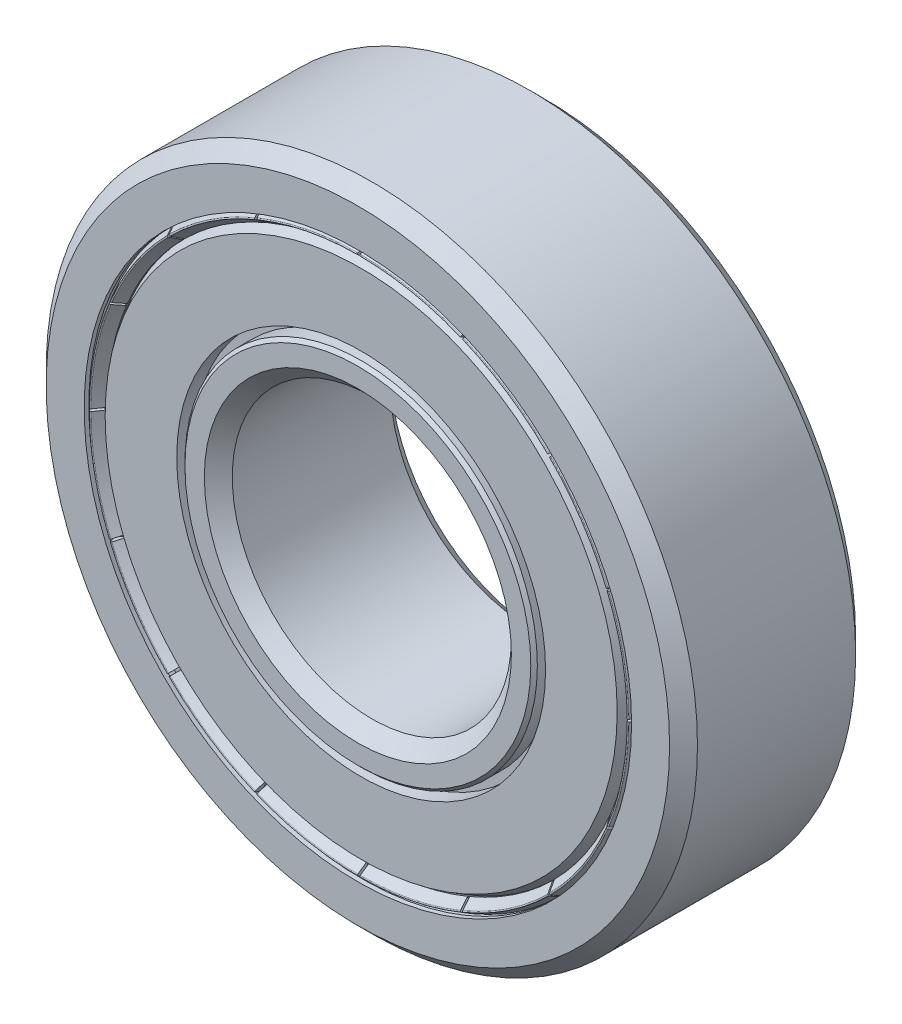
from build123d import *

# Parameters (mm, degrees)
CIRPATTERN1_COUNT  = 8
FILLET1_R          = 0.04
CUT_EXTRUDE1_START = 3.536162
CUT_EXTRUDE1_DEPTH = 17.662847877
CIRPATTERN2_COUNT  = 16


with BuildPart() as part:
    # Sketch3 → Revolve1 (revolve)
    with BuildSketch(Plane(origin=(0, 0, 0), x_dir=(0, 0, -1), z_dir=(1, 0, 0)), mode=Mode.PRIVATE) as revolve1_sk:
        with BuildLine():
            Line((3.4, 14), (-3.4, 14))
            Line((-3.4, 14), (-4, 13.4))
            Line((-4, 13.4), (-4, 11.766899549))
            Line((-4, 11.766899549), (-3.8, 11.766899549))
            Line((-3.8, 11.766899549), (-3.8, 12.283449774))
            Line((-3.8, 12.283449774), (-3.658578644, 12.424871131))
            Line((-3.658578644, 12.424871131), (-1.4, 12.424871131))
            ThreePointArc((-1.4, 12.424871131), (0, 12.8), (1.4, 12.424871131))
            Line((1.4, 12.424871131), (3.658578644, 12.424871131))
            Line((3.658578644, 12.424871131), (3.8, 12.283449774))
            Line((3.8, 12.283449774), (3.8, 11.766899549))
            Line((3.8, 11.766899549), (4, 11.766899549))
            Line((4, 11.766899549), (4, 13.4))
            Line((4, 13.4), (3.4, 14))
        make_face()
        with BuildLine():
            Line((3.4, 6), (-3.4, 6))
            Line((-3.4, 6), (-4, 6.6))
            Line((-4, 6.6), (-4, 7.433707513))
            Line((-4, 7.433707513), (-3.858578644, 7.575128869))
            Line((-3.858578644, 7.575128869), (-1.4, 7.575128869))
            ThreePointArc((-1.4, 7.575128869), (0, 7.2), (1.4, 7.575128869))
            Line((1.4, 7.575128869), (3.858578644, 7.575128869))
            Line((3.858578644, 7.575128869), (4, 7.433707513))
            Line((4, 7.433707513), (4, 6.6))
            Line((4, 6.6), (3.4, 6))
        make_face()
    revolve(revolve1_sk.sketch.rotate(Axis((0, 0, 4), (0, 0, -1)), 90), axis=Axis((0, 0, 4), (0, 0, -1)))


with BuildPart() as body_2:
    # Sketch4 → Revolve2 (revolve)
    with BuildSketch(Plane(origin=(0, 0, 0), x_dir=(0, 0, -1), z_dir=(1, 0, 0))):
        with BuildLine():
            Line((0, 12.8), (0, 7.2))
            ThreePointArc((0, 7.2), (-2.8, 10), (0, 12.8))
        make_face()
    revolve(axis=Axis((0, 14, 0), (0, -1, 0)))


with BuildPart() as cirpattern1_1:
    # CirPattern1: pattern copy
    add(body_2.part.rotate(Axis((0, 0, 0), (0, 0, 1)), 1 * 360 / CIRPATTERN1_COUNT))


with BuildPart() as cirpattern1_2:
    # CirPattern1: pattern copy
    add(body_2.part.rotate(Axis((0, 0, 0), (0, 0, 1)), 2 * 360 / CIRPATTERN1_COUNT))


with BuildPart() as cirpattern1_3:
    # CirPattern1: pattern copy
    add(body_2.part.rotate(Axis((0, 0, 0), (0, 0, 1)), 3 * 360 / CIRPATTERN1_COUNT))


with BuildPart() as cirpattern1_4:
    # CirPattern1: pattern copy
    add(body_2.part.rotate(Axis((0, 0, 0), (0, 0, 1)), 4 * 360 / CIRPATTERN1_COUNT))


with BuildPart() as cirpattern1_5:
    # CirPattern1: pattern copy
    add(body_2.part.rotate(Axis((0, 0, 0), (0, 0, 1)), 5 * 360 / CIRPATTERN1_COUNT))


with BuildPart() as cirpattern1_6:
    # CirPattern1: pattern copy
    add(body_2.part.rotate(Axis((0, 0, 0), (0, 0, 1)), 6 * 360 / CIRPATTERN1_COUNT))


with BuildPart() as cirpattern1_7:
    # CirPattern1: pattern copy
    add(body_2.part.rotate(Axis((0, 0, 0), (0, 0, 1)), 7 * 360 / CIRPATTERN1_COUNT))


with BuildPart() as body_10:
    # Sketch5 → Revolve3 (revolve)
    with BuildSketch(Plane(origin=(0, 0, 0), x_dir=(0, 0, -1), z_dir=(1, 0, 0)), mode=Mode.PRIVATE) as revolve3_sk:
        Polygon((-2.8, 7.575128869), (-3.152859548, 7.575128869), (-3.152859548, 7.927988417), (-3.858578644, 7.927988417), (-3.858578644, 11.006592891), (-3.152859548, 11.414040001), (-2.8, 11.414040001), align=None)
        Polygon((3.152859548, 11.414040001), (2.8, 11.414040001), (2.8, 7.575128869), (3.152859548, 7.575128869), (3.152859548, 7.927988417), (3.858578644, 7.927988417), (3.858578644, 11.006592891), align=None)
    revolve(revolve3_sk.sketch.rotate(Axis((0, 0, 4), (0, 0, -1)), 90), axis=Axis((0, 0, 4), (0, 0, -1)))


with BuildPart() as body_11:
    # Sketch6 → Revolve4 (revolve)
    with BuildSketch(Plane(origin=(0, 0, 0), x_dir=(0, 0, -1), z_dir=(1, 0, 0)), mode=Mode.PRIVATE) as revolve4_sk:
        Polygon((-3.422323765, 11.766899549), (-3.65, 11.766899549), (-4, 11.564826955), (-3.542323765, 11.244358604), (-3.502323765, 11.244358604), (-3.422323765, 11.258464763), align=None)
    revolve(revolve4_sk.sketch.rotate(Axis((0, 0, 4), (0, 0, -1)), 90), axis=Axis((0, 0, 4), (0, 0, -1)))

    # Fillet1
    fillet1_edges = [body_11.edges().sort_by_distance(p)[0] for p in [
        (-11.564826955, 0, 4),
    ]]
    fillet(fillet1_edges, radius=FILLET1_R)

    # Sketch7 → Cut-Extrude1 (cut, through all)
    with BuildSketch(Plane.XY.offset(CUT_EXTRUDE1_START)):
        Polygon((-0.05, 11.766899549), (-0.05, 11.866899549), (0.05, 11.866899549), (0.05, 11.766899549), (0.05, 11.244358604), (0.05, 11.144358604), (-0.05, 11.144358604), (-0.05, 11.244358604), align=None)
    cut_extrude1 = extrude(amount=CUT_EXTRUDE1_DEPTH, mode=Mode.SUBTRACT)

    # CirPattern2: Cut-Extrude1 ×16 about axis
    cirpattern2_axis = Axis((0, 0, 4), (0, 0, -1))
    for i in range(1, CIRPATTERN2_COUNT):
        add(cut_extrude1.rotate(cirpattern2_axis, i * 360 / CIRPATTERN2_COUNT), mode=Mode.SUBTRACT)


with BuildPart() as body_12:
    # Mirror1: mirrored copy
    add(body_11.part.mirror(Plane.XY))


solid = Compound([part.part, body_2.part, cirpattern1_1.part, cirpattern1_2.part, cirpattern1_3.part, cirpattern1_4.part, cirpattern1_5.part, cirpattern1_6.part, cirpattern1_7.part, body_10.part, body_11.part, body_12.part])
